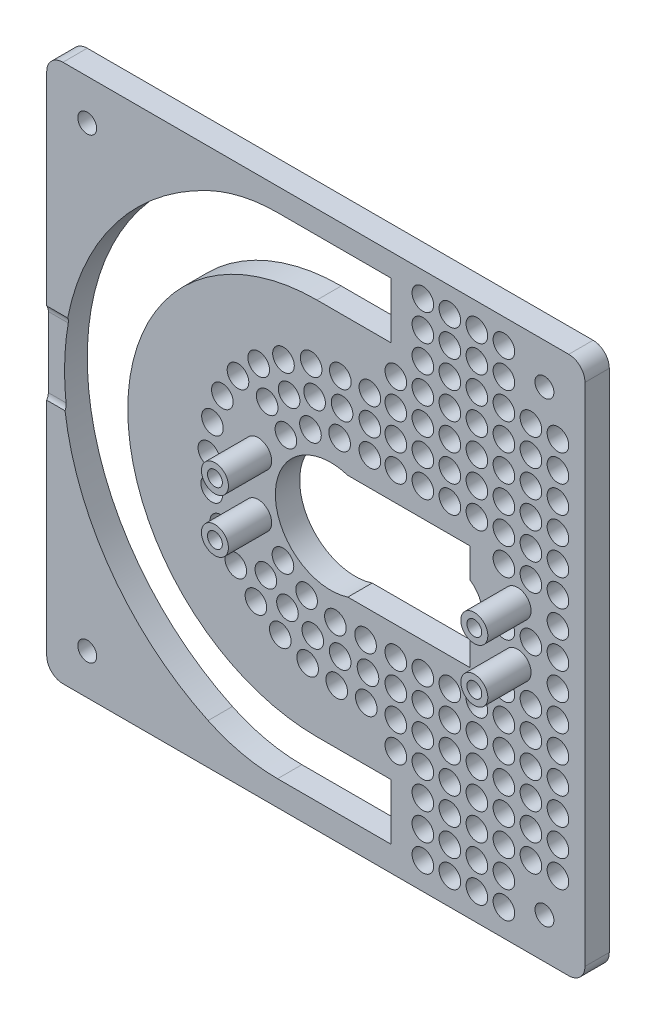
from build123d import *

# Parameters (mm, degrees)
BOSS_EXTRUDE1_DEPTH      = 3
BOSS_EXTRUDE1_DEPTH_BACK = 1.5
SKETCH1_W                = 99.6
SKETCH1_H                = 99.6
SKETCH1_R                = 7.5
SKETCH2_W                = 99.6
SKETCH2_H                = 99.6
SKETCH2_W_2              = 95.6
SKETCH2_H_2              = 95.6
BOSS_EXTRUDE2_DEPTH      = 55
FILLET1_R                = 3
SKETCH5_R                = 3
BOSS_EXTRUDE4_DEPTH      = 55
SKETCH6_R                = 1.5
CUT_EXTRUDE2_DEPTH       = 10
CUT_EXTRUDE4_START       = -99.6
CUT_EXTRUDE4_DEPTH       = 99.6
SKETCH8_W                = 17
SKETCH8_H                = 12.2
SKETCH8_H_2              = 9.2
CUT_EXTRUDE5_DEPTH       = 10
CUT_EXTRUDE13_DEPTH      = 4.5
SKETCH20_7_W             = 13.718214861
SKETCH20_7_H             = 12
CUT_EXTRUDE16_DEPTH      = 4.5
CUT_EXTRUDE17_DEPTH      = 10
SKETCH22_R               = 1.4
CUT_EXTRUDE18_DEPTH      = 10
SKETCH26_R               = 2
CUT_EXTRUDE21_DEPTH      = 4.5
SKETCH29_R               = 2
BOSS_EXTRUDE9_DEPTH      = 4.5
SKETCH30_R               = 2
CUT_EXTRUDE23_DEPTH      = 4.5
CRVPATTERN2_START        = -1.5
CRVPATTERN2_OUTLINE_R    = 2
CRVPATTERN2_DEPTH        = 4.5
SKETCH32_R               = 2
CUT_EXTRUDE24_DEPTH      = 4.5
CRVPATTERN3_START        = -1.5
CRVPATTERN3_OUTLINE_R    = 2
CRVPATTERN3_DEPTH        = 4.5
SKETCH36_R               = 2
CUT_EXTRUDE25_DEPTH      = 4.5
CRVPATTERN4_START        = -1.5
CRVPATTERN4_OUTLINE_R    = 2
CRVPATTERN4_DEPTH        = 4.5
SKETCH37_W               = 26.02554601
SKETCH37_H               = 3
SKETCH37_W_2             = 26.013358107
BOSS_EXTRUDE11_DEPTH     = 4.5
FILLET2_R                = 30
SKETCH38_R               = 2.5
SKETCH38_R_2             = 1.375
BOSS_EXTRUDE12_DEPTH     = 8
CUT_EXTRUDE27_DEPTH      = 2
SKETCH40_R               = 1.75
CUT_EXTRUDE31_DEPTH      = 10
CUT_EXTRUDE32_DEPTH      = 55
CUT_EXTRUDE35_DEPTH      = 10
CUT_EXTRUDE36_DEPTH      = 4.5
SKETCH44_R               = 1.5
CUT_EXTRUDE37_DEPTH      = 2


# Read off the part's stored shape, not the designer's step: CrvPattern2, CrvPattern3, CrvPattern4
with BuildPart() as part:
    # Sketch1 → Boss-Extrude1 (new, two sides: drawn at the far end of the back side and taken through both)
    with BuildSketch(Plane.XY.offset(-BOSS_EXTRUDE1_DEPTH_BACK)):
        with Locations((-24.95, -0.2)):
            Rectangle(SKETCH1_W, SKETCH1_H)
        with Locations((-22.104673791, 0)):
            Circle(SKETCH1_R, mode=Mode.SUBTRACT)
    extrude(amount=BOSS_EXTRUDE1_DEPTH + BOSS_EXTRUDE1_DEPTH_BACK)

    # Sketch2 → Boss-Extrude2 (add)
    with BuildSketch(Plane.XY.offset(3)):
        with Locations((-24.95, -0.2)):
            Rectangle(SKETCH2_W, SKETCH2_H)
        with Locations((-24.95, -0.2)):
            Rectangle(SKETCH2_W_2, SKETCH2_H_2, mode=Mode.SUBTRACT)
    extrude(amount=BOSS_EXTRUDE2_DEPTH)

    # Fillet1
    fillet1_edges = [part.edges().sort_by_distance(p)[0] for p in [
        (-72.75, -48, 30.5),
        (22.85, -48, 30.5),
        (22.85, 47.6, 30.5),
        (-72.75, 47.6, 30.5),
        (-74.75, 49.6, 28.25),
        (24.85, 49.6, 28.25),
        (24.85, -50, 28.25),
        (-74.75, -50, 28.25),
    ]]
    fillet(fillet1_edges, radius=FILLET1_R)

    # Sketch5 → Boss-Extrude4 (add)
    with BuildSketch(Plane.XY.offset(3)):
        with Locations((17.35, 42.1)):
            Circle(SKETCH5_R)
        with Locations((17.35, -42.5)):
            Circle(SKETCH5_R)
        with Locations((-67.25, 42.1)):
            Circle(SKETCH5_R)
        with Locations((-67.25, -42.5)):
            Circle(SKETCH5_R)
    extrude(amount=BOSS_EXTRUDE4_DEPTH)

    # Sketch6 → Cut-Extrude2 (cut)
    with BuildSketch(Plane.XY.offset(58)):
        with Locations((17.35, 42.1)):
            Circle(SKETCH6_R)
        with Locations((17.35, -42.5)):
            Circle(SKETCH6_R)
        with Locations((-67.25, -42.5)):
            Circle(SKETCH6_R)
        with Locations((-67.25, 42.1)):
            Circle(SKETCH6_R)
    extrude(amount=-CUT_EXTRUDE2_DEPTH, mode=Mode.SUBTRACT)

    # Sketch7 → Cut-Extrude4 (cut)
    with BuildSketch(Plane.XZ.offset(50).offset(CUT_EXTRUDE4_START)):
        with BuildLine():
            Line((12.05, 8.25), (12.05, 48.25))
            ThreePointArc((12.05, 48.25), (10.05, 50.25), (8.05, 48.25))
            Line((8.05, 48.25), (8.05, 8.25))
            ThreePointArc((8.05, 8.25), (10.05, 6.25), (12.05, 8.25))
        make_face()
        with BuildLine():
            Line((-1.95, 8.25), (-1.95, 48.25))
            ThreePointArc((-1.95, 48.25), (0.05, 50.25), (2.05, 48.25))
            Line((2.05, 48.25), (2.05, 8.25))
            ThreePointArc((2.05, 8.25), (0.05, 6.25), (-1.95, 8.25))
        make_face()
        with BuildLine():
            Line((-11.95, 8.25), (-11.95, 48.25))
            ThreePointArc((-11.95, 48.25), (-9.95, 50.25), (-7.95, 48.25))
            Line((-7.95, 48.25), (-7.95, 8.25))
            ThreePointArc((-7.95, 8.25), (-9.95, 6.25), (-11.95, 8.25))
        make_face()
        with BuildLine():
            Line((-21.95, 8.25), (-21.95, 48.25))
            ThreePointArc((-21.95, 48.25), (-19.95, 50.25), (-17.95, 48.25))
            Line((-17.95, 48.25), (-17.95, 8.25))
            ThreePointArc((-17.95, 8.25), (-19.95, 6.25), (-21.95, 8.25))
        make_face()
        with BuildLine():
            Line((-31.95, 8.25), (-31.95, 48.25))
            ThreePointArc((-31.95, 48.25), (-29.95, 50.25), (-27.95, 48.25))
            Line((-27.95, 48.25), (-27.95, 8.25))
            ThreePointArc((-27.95, 8.25), (-29.95, 6.25), (-31.95, 8.25))
        make_face()
        with BuildLine():
            Line((-41.95, 8.25), (-41.95, 48.25))
            ThreePointArc((-41.95, 48.25), (-39.95, 50.25), (-37.95, 48.25))
            Line((-37.95, 48.25), (-37.95, 8.25))
            ThreePointArc((-37.95, 8.25), (-39.95, 6.25), (-41.95, 8.25))
        make_face()
        with BuildLine():
            Line((-51.95, 8.25), (-51.95, 48.25))
            ThreePointArc((-51.95, 48.25), (-49.95, 50.25), (-47.95, 48.25))
            Line((-47.95, 48.25), (-47.95, 8.25))
            ThreePointArc((-47.95, 8.25), (-49.95, 6.25), (-51.95, 8.25))
        make_face()
        with BuildLine():
            Line((-61.95, 8.25), (-61.95, 48.25))
            ThreePointArc((-61.95, 48.25), (-59.95, 50.25), (-57.95, 48.25))
            Line((-57.95, 48.25), (-57.95, 8.25))
            ThreePointArc((-57.95, 8.25), (-59.95, 6.25), (-61.95, 8.25))
        make_face()
    cut_extrude4 = extrude(amount=CUT_EXTRUDE4_DEPTH, mode=Mode.SUBTRACT)

    # Mirror1: Cut-Extrude4 across plane
    add(cut_extrude4.mirror(Plane.ZX), mode=Mode.SUBTRACT)

    # Sketch8 → Cut-Extrude5 (cut)
    with BuildSketch(Plane.ZY.offset(74.75)):
        with Locations((49.5, -10.4)):
            Rectangle(SKETCH8_W, SKETCH8_H)
        with Locations((49.5, 19.6)):
            Rectangle(SKETCH8_W, SKETCH8_H_2)
    extrude(amount=-CUT_EXTRUDE5_DEPTH, mode=Mode.SUBTRACT)

    # Sketch20 → Cut-Extrude13 (cut)
    with BuildSketch(Plane(origin=(0, 0, -1.5), x_dir=(-1, 0, 0), z_dir=(0, 0, -1))):
        with BuildLine():
            ThreePointArc((24.75, -47), (71.75, 0), (24.75, 47))
            Line((24.75, 47), (24.75, 35))
            ThreePointArc((24.75, 35), (59.75, 0), (24.75, -35))
            Line((24.75, -35), (24.75, -47))
        make_face()
    extrude(amount=-CUT_EXTRUDE13_DEPTH, mode=Mode.SUBTRACT)

    # Sketch20<7> → Cut-Extrude16 (cut)
    with BuildSketch(Plane(origin=(0, 0, -1.5), x_dir=(-1, 0, 0), z_dir=(0, 0, -1))):
        with Locations((17.89089257, 41)):
            Rectangle(SKETCH20_7_W, SKETCH20_7_H)
        with Locations((17.89089257, -41)):
            Rectangle(SKETCH20_7_W, SKETCH20_7_H)
    extrude(amount=-CUT_EXTRUDE16_DEPTH, mode=Mode.SUBTRACT)

    # Sketch21 → Cut-Extrude17 (cut)
    with BuildSketch(Plane.ZY.offset(74.75)):
        with BuildLine():
            Line((4.7, -7), (16.2, -7))
            ThreePointArc((16.2, -7), (17.614213562, -6.414213562), (18.2, -5))
            Line((18.2, -5), (18.2, 8))
            ThreePointArc((18.2, 8), (17.614213562, 9.414213562), (16.2, 10))
            Line((16.2, 10), (4.7, 10))
            ThreePointArc((4.7, 10), (3.285786438, 9.414213562), (2.7, 8))
            Line((2.7, 8), (2.7, -5))
            ThreePointArc((2.7, -5), (3.285786438, -6.414213562), (4.7, -7))
        make_face()
    extrude(amount=-CUT_EXTRUDE17_DEPTH, mode=Mode.SUBTRACT)

    # Sketch22 → Cut-Extrude18 (cut)
    with BuildSketch(Plane(origin=(-72.75, 0, 0), x_dir=(0, 0, -1), z_dir=(1, 0, 0))):
        with Locations(Location((-28.5, 1.5, 0), (0, 0, 90))):
            Circle(SKETCH22_R)
    extrude(amount=-CUT_EXTRUDE18_DEPTH, mode=Mode.SUBTRACT)

    # Sketch26 → Cut-Extrude21 (cut)
    with BuildSketch(Plane(origin=(0, 0, -1.5), x_dir=(-1, 0, 0), z_dir=(0, 0, -1))):
        with Locations((-19.85, -45)):
            Circle(SKETCH26_R)
        with Locations((-19.85, -40)):
            Circle(SKETCH26_R)
        with Locations((-19.85, -35)):
            Circle(SKETCH26_R)
        with Locations((-19.85, -30)):
            Circle(SKETCH26_R)
        with Locations((-19.85, -25)):
            Circle(SKETCH26_R)
        with Locations((-19.85, -20)):
            Circle(SKETCH26_R)
        with Locations((-19.85, -15)):
            Circle(SKETCH26_R)
        with Locations((-19.85, -10)):
            Circle(SKETCH26_R)
        with Locations((-19.85, -5)):
            Circle(SKETCH26_R)
        with Locations((-19.85, 0)):
            Circle(SKETCH26_R)
        with Locations((-19.85, 5)):
            Circle(SKETCH26_R)
        with Locations((-19.85, 10)):
            Circle(SKETCH26_R)
        with Locations((-19.85, 15)):
            Circle(SKETCH26_R)
        with Locations((-19.85, 20)):
            Circle(SKETCH26_R)
        with Locations((-19.85, 25)):
            Circle(SKETCH26_R)
        with Locations((-19.85, 30)):
            Circle(SKETCH26_R)
        with Locations((-19.85, 35)):
            Circle(SKETCH26_R)
        with Locations((-19.85, 40)):
            Circle(SKETCH26_R)
        with Locations((-19.85, 45)):
            Circle(SKETCH26_R)
        with Locations((-14.85, -45)):
            Circle(SKETCH26_R)
        with Locations((-9.85, -45)):
            Circle(SKETCH26_R)
        with Locations((-4.85, -45)):
            Circle(SKETCH26_R)
        with Locations((0.15, -45)):
            Circle(SKETCH26_R)
        with Locations((5.15, -45)):
            Circle(SKETCH26_R)
        with Locations((-14.85, -40)):
            Circle(SKETCH26_R)
        with Locations((-9.85, -40)):
            Circle(SKETCH26_R)
        with Locations((-4.85, -40)):
            Circle(SKETCH26_R)
        with Locations((0.15, -40)):
            Circle(SKETCH26_R)
        with Locations((5.15, -40)):
            Circle(SKETCH26_R)
        with Locations((-14.85, -35)):
            Circle(SKETCH26_R)
        with Locations((-9.85, -35)):
            Circle(SKETCH26_R)
        with Locations((-4.85, -35)):
            Circle(SKETCH26_R)
        with Locations((0.15, -35)):
            Circle(SKETCH26_R)
        with Locations((5.15, -35)):
            Circle(SKETCH26_R)
        with Locations((-14.85, -30)):
            Circle(SKETCH26_R)
        with Locations((-9.85, -30)):
            Circle(SKETCH26_R)
        with Locations((-4.85, -30)):
            Circle(SKETCH26_R)
        with Locations((0.15, -30)):
            Circle(SKETCH26_R)
        with Locations((5.15, -30)):
            Circle(SKETCH26_R)
        with Locations((-14.85, -25)):
            Circle(SKETCH26_R)
        with Locations((-9.85, -25)):
            Circle(SKETCH26_R)
        with Locations((-4.85, -25)):
            Circle(SKETCH26_R)
        with Locations((0.15, -25)):
            Circle(SKETCH26_R)
        with Locations((5.15, -25)):
            Circle(SKETCH26_R)
        with Locations((-14.85, -20)):
            Circle(SKETCH26_R)
        with Locations((-9.85, -20)):
            Circle(SKETCH26_R)
        with Locations((-4.85, -20)):
            Circle(SKETCH26_R)
        with Locations((0.15, -20)):
            Circle(SKETCH26_R)
        with Locations((5.15, -20)):
            Circle(SKETCH26_R)
        with Locations((-14.85, -15)):
            Circle(SKETCH26_R)
        with Locations((-9.85, -15)):
            Circle(SKETCH26_R)
        with Locations((-4.85, -15)):
            Circle(SKETCH26_R)
        with Locations((0.15, -15)):
            Circle(SKETCH26_R)
        with Locations((5.15, -15)):
            Circle(SKETCH26_R)
        with Locations((-14.85, -10)):
            Circle(SKETCH26_R)
        with Locations((-9.85, -10)):
            Circle(SKETCH26_R)
        with Locations((-14.85, 0)):
            Circle(SKETCH26_R)
        with Locations((-9.85, 0)):
            Circle(SKETCH26_R)
        with Locations((-14.85, 10)):
            Circle(SKETCH26_R)
        with Locations((-9.85, 10)):
            Circle(SKETCH26_R)
        with Locations((-14.85, 15)):
            Circle(SKETCH26_R)
        with Locations((-9.85, 15)):
            Circle(SKETCH26_R)
        with Locations((-4.85, 15)):
            Circle(SKETCH26_R)
        with Locations((0.15, 15)):
            Circle(SKETCH26_R)
        with Locations((5.15, 15)):
            Circle(SKETCH26_R)
        with Locations((-14.85, 20)):
            Circle(SKETCH26_R)
        with Locations((-9.85, 20)):
            Circle(SKETCH26_R)
        with Locations((-4.85, 20)):
            Circle(SKETCH26_R)
        with Locations((0.15, 20)):
            Circle(SKETCH26_R)
        with Locations((5.15, 20)):
            Circle(SKETCH26_R)
        with Locations((-14.85, 25)):
            Circle(SKETCH26_R)
        with Locations((-9.85, 25)):
            Circle(SKETCH26_R)
        with Locations((-4.85, 25)):
            Circle(SKETCH26_R)
        with Locations((0.15, 25)):
            Circle(SKETCH26_R)
        with Locations((5.15, 25)):
            Circle(SKETCH26_R)
        with Locations((-14.85, 30)):
            Circle(SKETCH26_R)
        with Locations((-9.85, 30)):
            Circle(SKETCH26_R)
        with Locations((-4.85, 30)):
            Circle(SKETCH26_R)
        with Locations((0.15, 30)):
            Circle(SKETCH26_R)
        with Locations((5.15, 30)):
            Circle(SKETCH26_R)
        with Locations((-14.85, 35)):
            Circle(SKETCH26_R)
        with Locations((-9.85, 35)):
            Circle(SKETCH26_R)
        with Locations((-4.85, 35)):
            Circle(SKETCH26_R)
        with Locations((0.15, 35)):
            Circle(SKETCH26_R)
        with Locations((5.15, 35)):
            Circle(SKETCH26_R)
        with Locations((-14.85, 40)):
            Circle(SKETCH26_R)
        with Locations((-9.85, 40)):
            Circle(SKETCH26_R)
        with Locations((-4.85, 40)):
            Circle(SKETCH26_R)
        with Locations((0.15, 40)):
            Circle(SKETCH26_R)
        with Locations((5.15, 40)):
            Circle(SKETCH26_R)
        with Locations((-14.85, 45)):
            Circle(SKETCH26_R)
        with Locations((-9.85, 45)):
            Circle(SKETCH26_R)
        with Locations((-4.85, 45)):
            Circle(SKETCH26_R)
        with Locations((0.15, 45)):
            Circle(SKETCH26_R)
        with Locations((5.15, 45)):
            Circle(SKETCH26_R)
        with Locations((10.15, -30)):
            Circle(SKETCH26_R)
        with Locations((10.15, -25)):
            Circle(SKETCH26_R)
        with Locations((10.15, -20)):
            Circle(SKETCH26_R)
        with Locations((10.15, -15)):
            Circle(SKETCH26_R)
        with Locations((10.15, 15)):
            Circle(SKETCH26_R)
        with Locations((10.15, 20)):
            Circle(SKETCH26_R)
        with Locations((10.15, 25)):
            Circle(SKETCH26_R)
        with Locations((10.15, 30)):
            Circle(SKETCH26_R)
    extrude(amount=-CUT_EXTRUDE21_DEPTH, mode=Mode.SUBTRACT)

    # Sketch29 → Boss-Extrude9 (add)
    with BuildSketch(Plane(origin=(0, 0, -1.5), x_dir=(-1, 0, 0), z_dir=(0, 0, -1))):
        with Locations((-19.85, 40)):
            Circle(SKETCH29_R)
        with Locations((-19.85, 45)):
            Circle(SKETCH29_R)
        with Locations((-14.85, 45)):
            Circle(SKETCH29_R)
        with Locations((-14.85, 40)):
            Circle(SKETCH29_R)
        with Locations((-19.85, -40)):
            Circle(SKETCH29_R)
        with Locations((-19.85, -45)):
            Circle(SKETCH29_R)
        with Locations((-14.85, -45)):
            Circle(SKETCH29_R)
        with Locations((-14.85, -40)):
            Circle(SKETCH29_R)
    extrude(amount=-BOSS_EXTRUDE9_DEPTH)

    # Sketch30 → Cut-Extrude23 (cut)
    with BuildSketch(Plane(origin=(0, 0, -1.5), x_dir=(-1, 0, 0), z_dir=(0, 0, -1))):
        with Locations((14.95, 20)):
            Circle(SKETCH30_R)
    extrude(amount=-CUT_EXTRUDE23_DEPTH, mode=Mode.SUBTRACT)

    # CrvPattern2 outline → CrvPattern2 (cut)
    with BuildSketch(Plane.XY.offset(CRVPATTERN2_START)):
        with Locations((-20.098772525, 19.996958712)):
            Circle(CRVPATTERN2_OUTLINE_R)
        with Locations((-25.178610025, 19.249160844)):
            Circle(CRVPATTERN2_OUTLINE_R)
        with Locations((-29.900648507, 17.232653159)):
            Circle(CRVPATTERN2_OUTLINE_R)
        with Locations((-33.953658998, 14.080343429)):
            Circle(CRVPATTERN2_OUTLINE_R)
        with Locations((-34.197040973, -13.830510009)):
            Circle(CRVPATTERN2_OUTLINE_R)
        with Locations((-30.199618752, -17.05301932)):
            Circle(CRVPATTERN2_OUTLINE_R)
        with Locations((-25.513463448, -19.151566231)):
            Circle(CRVPATTERN2_OUTLINE_R)
        with Locations((-20.447438978, -19.987835773)):
            Circle(CRVPATTERN2_OUTLINE_R)
        with Locations((-15.298790205, -20)):
            Circle(CRVPATTERN2_OUTLINE_R)
    extrude(amount=CRVPATTERN2_DEPTH, mode=Mode.SUBTRACT)

    # Sketch32 → Cut-Extrude24 (cut)
    with BuildSketch(Plane(origin=(0, 0, -1.5), x_dir=(-1, 0, 0), z_dir=(0, 0, -1))):
        with Locations((14.95, 15)):
            Circle(SKETCH32_R)
    extrude(amount=-CUT_EXTRUDE24_DEPTH, mode=Mode.SUBTRACT)

    # CrvPattern3 outline → CrvPattern3 (cut)
    with BuildSketch(Plane.XY.offset(CRVPATTERN3_START)):
        with Locations((-20.542711439, 14.979038974)):
            Circle(CRVPATTERN3_OUTLINE_R)
        with Locations((-25.944978829, 13.660974976)):
            Circle(CRVPATTERN3_OUTLINE_R)
        with Locations((-30.495869297, 10.465481024)):
            Circle(CRVPATTERN3_OUTLINE_R)
        with Locations((-31.033926769, -9.882964974)):
            Circle(CRVPATTERN3_OUTLINE_R)
        with Locations((-26.658269364, -13.3144964)):
            Circle(CRVPATTERN3_OUTLINE_R)
        with Locations((-21.333207406, -14.916214477)):
            Circle(CRVPATTERN3_OUTLINE_R)
        with Locations((-15.743080891, -15)):
            Circle(CRVPATTERN3_OUTLINE_R)
    extrude(amount=CRVPATTERN3_DEPTH, mode=Mode.SUBTRACT)

    # Sketch36 → Cut-Extrude25 (cut)
    with BuildSketch(Plane(origin=(0, 0, -1.5), x_dir=(-1, 0, 0), z_dir=(0, 0, -1))):
        with Locations((14.95, 25)):
            Circle(SKETCH36_R)
    extrude(amount=-CUT_EXTRUDE25_DEPTH, mode=Mode.SUBTRACT)

    # CrvPattern4 outline → CrvPattern4 (cut)
    with BuildSketch(Plane.XY.offset(CRVPATTERN4_START)):
        with Locations((-20.416968875, 24.991101467)):
            Circle(CRVPATTERN4_OUTLINE_R)
        with Locations((-15.61704802, -25)):
            Circle(CRVPATTERN4_OUTLINE_R)
        with Locations((-21.083462946, -24.964412202)):
            Circle(CRVPATTERN4_OUTLINE_R)
        with Locations((-26.467563085, -24.080580271)):
            Circle(CRVPATTERN4_OUTLINE_R)
        with Locations((-42.536029609, -10.285759799)):
            Circle(CRVPATTERN4_OUTLINE_R)
        with Locations((-39.76193826, -14.98406911)):
            Circle(CRVPATTERN4_OUTLINE_R)
        with Locations((-36.034648091, -18.968664596)):
            Circle(CRVPATTERN4_OUTLINE_R)
        with Locations((-31.531695558, -22.049753962)):
            Circle(CRVPATTERN4_OUTLINE_R)
        with Locations((-44.224787982, -5.097524227)):
            Circle(CRVPATTERN4_OUTLINE_R)
        with Locations((-44.747775268, 0.333514117)):
            Circle(CRVPATTERN4_OUTLINE_R)
        with Locations((-44.080080793, 5.74866668)):
            Circle(CRVPATTERN4_OUTLINE_R)
        with Locations((-42.253507854, 10.890001574)):
            Circle(CRVPATTERN4_OUTLINE_R)
        with Locations((-35.522791356, 19.396367001)):
            Circle(CRVPATTERN4_OUTLINE_R)
        with Locations((-39.355058875, 15.512629258)):
            Circle(CRVPATTERN4_OUTLINE_R)
        with Locations((-30.939241982, 22.356226512)):
            Circle(CRVPATTERN4_OUTLINE_R)
        with Locations((-25.822732126, 24.251225217)):
            Circle(CRVPATTERN4_OUTLINE_R)
    extrude(amount=CRVPATTERN4_DEPTH, mode=Mode.SUBTRACT)

    # Sketch37 → Boss-Extrude11 (add)
    with BuildSketch(Plane(origin=(0, 0, -1.5), x_dir=(-1, 0, 0), z_dir=(0, 0, -1))):
        with Locations((24.044558144, -46.86)):
            Rectangle(SKETCH37_W, SKETCH37_H)
        with Locations((24.038464193, 46.863305133)):
            Rectangle(SKETCH37_W_2, SKETCH37_H)
    extrude(amount=-BOSS_EXTRUDE11_DEPTH)

    # Fillet2
    fillet2_edges = [part.edges().sort_by_distance(p)[0] for p in [
        (-37.057331149, -45.36, 0.75),
        (-37.045143246, 45.363305133, 0.75),
    ]]
    fillet(fillet2_edges, radius=FILLET2_R)

    # Sketch38 → Boss-Extrude12 (add)
    # profile 1 of 4: a face of its own
    with BuildSketch(Plane.XY.offset(3)):
        with Locations((-35.624093115, -4.902903378)):
            Circle(SKETCH38_R)
        with Locations((-35.624093115, -4.902903378)):
            Circle(SKETCH38_R_2, mode=Mode.SUBTRACT)
    # profile 2 of 4: a face of its own
    with BuildSketch(Plane.XY.offset(3)):
        with Locations((-35.624093115, 5)):
            Circle(SKETCH38_R)
        with Locations((-35.624093115, 5)):
            Circle(SKETCH38_R_2, mode=Mode.SUBTRACT)
    # profile 3 of 4: a face of its own
    with BuildSketch(Plane.XY.offset(3)):
        with Locations((12.375906885, 5)):
            Circle(SKETCH38_R)
        with Locations((12.375906885, 5)):
            Circle(SKETCH38_R_2, mode=Mode.SUBTRACT)
    # profile 4 of 4: a face of its own
    with BuildSketch(Plane.XY.offset(3)):
        with Locations((12.375906885, -4.902903378)):
            Circle(SKETCH38_R)
        with Locations((12.375906885, -4.902903378)):
            Circle(SKETCH38_R_2, mode=Mode.SUBTRACT)
    extrude(amount=BOSS_EXTRUDE12_DEPTH)

    # Sketch39 → Cut-Extrude27 (cut)
    with BuildSketch(Plane(origin=(24.85, 0, 0), x_dir=(0, 0, -1), z_dir=(1, 0, 0))):
        with BuildLine():
            Line((-10.75, 36.8), (-50.75, 36.8))
            ThreePointArc((-50.75, 36.8), (-52.75, 34.8), (-50.75, 32.8))
            Line((-50.75, 32.8), (-10.75, 32.8))
            ThreePointArc((-10.75, 32.8), (-8.75, 34.8), (-10.75, 36.8))
        make_face()
        with BuildLine():
            Line((-50.75, 22.8), (-10.75, 22.8))
            ThreePointArc((-10.75, 22.8), (-8.75, 24.8), (-10.75, 26.8))
            Line((-10.75, 26.8), (-50.75, 26.8))
            ThreePointArc((-50.75, 26.8), (-52.75, 24.8), (-50.75, 22.8))
        make_face()
        with BuildLine():
            Line((-50.75, 12.8), (-10.75, 12.8))
            ThreePointArc((-10.75, 12.8), (-8.75, 14.8), (-10.75, 16.8))
            Line((-10.75, 16.8), (-50.75, 16.8))
            ThreePointArc((-50.75, 16.8), (-52.75, 14.8), (-50.75, 12.8))
        make_face()
        with BuildLine():
            Line((-50.75, 2.8), (-10.75, 2.8))
            ThreePointArc((-10.75, 2.8), (-8.75, 4.8), (-10.75, 6.8))
            Line((-10.75, 6.8), (-50.75, 6.8))
            ThreePointArc((-50.75, 6.8), (-52.75, 4.8), (-50.75, 2.8))
        make_face()
        with BuildLine():
            Line((-50.75, -7.2), (-10.75, -7.2))
            ThreePointArc((-10.75, -7.2), (-8.75, -5.2), (-10.75, -3.2))
            Line((-10.75, -3.2), (-50.75, -3.2))
            ThreePointArc((-50.75, -3.2), (-52.75, -5.2), (-50.75, -7.2))
        make_face()
        with BuildLine():
            Line((-50.75, -17.2), (-10.75, -17.2))
            ThreePointArc((-10.75, -17.2), (-8.75, -15.2), (-10.75, -13.2))
            Line((-10.75, -13.2), (-50.75, -13.2))
            ThreePointArc((-50.75, -13.2), (-52.75, -15.2), (-50.75, -17.2))
        make_face()
        with BuildLine():
            Line((-50.75, -27.2), (-10.75, -27.2))
            ThreePointArc((-10.75, -27.2), (-8.75, -25.2), (-10.75, -23.2))
            Line((-10.75, -23.2), (-50.75, -23.2))
            ThreePointArc((-50.75, -23.2), (-52.75, -25.2), (-50.75, -27.2))
        make_face()
        with BuildLine():
            Line((-50.75, -37.2), (-10.75, -37.2))
            ThreePointArc((-10.75, -37.2), (-8.75, -35.2), (-10.75, -33.2))
            Line((-10.75, -33.2), (-50.75, -33.2))
            ThreePointArc((-50.75, -33.2), (-52.75, -35.2), (-50.75, -37.2))
        make_face()
    extrude(amount=-CUT_EXTRUDE27_DEPTH, mode=Mode.SUBTRACT)

    # Sketch40 → Cut-Extrude31 (cut)
    with BuildSketch(Plane.XY.offset(3)):
        with Locations((17.35, -42.5)):
            Circle(SKETCH40_R)
        with Locations((-67.25, -42.5)):
            Circle(SKETCH40_R)
        with Locations((-67.25, 42.1)):
            Circle(SKETCH40_R)
        with Locations((17.35, 42.1)):
            Circle(SKETCH40_R)
    extrude(amount=-CUT_EXTRUDE31_DEPTH, mode=Mode.SUBTRACT)

    # Sketch41 → Cut-Extrude32 (cut)
    with BuildSketch(Plane.XY.offset(3)):
        Polygon((35.771120156, 51.696135285), (35.771120156, -68.339230689), (-98.454568293, -68.339230689), (-95.460668494, 61.230928926), align=None)
        Polygon((18.480492177, 13.542451262), (18.480492177, -12.758182434), (-49.618536882, -12.758182434), (-49.618536882, 16.478808638), align=None, mode=Mode.SUBTRACT)
    extrude(amount=CUT_EXTRUDE32_DEPTH, mode=Mode.SUBTRACT)

    # Sketch42 → Cut-Extrude35 (cut)
    with BuildSketch(Plane(origin=(0, 0, -1.5), x_dir=(-1, 0, 0), z_dir=(0, 0, -1))):
        with BuildLine():
            Line((-3.057683491, 9.75), (-3.057683491, 4.242640687))
            ThreePointArc((-3.057683491, 4.242640687), (-5.057683491, 0), (-3.057683491, -4.242640687))
            Line((-3.057683491, -4.242640687), (-3.057683491, -9.75))
            Line((-3.057683491, -9.75), (19.030038849, -9.75))
            ThreePointArc((19.030038849, -9.75), (32.442316509, 0), (19.030038849, 9.75))
            Line((19.030038849, 9.75), (-3.057683491, 9.75))
        make_face()
    extrude(amount=-CUT_EXTRUDE35_DEPTH, mode=Mode.SUBTRACT)

    # Sketch43 → Cut-Extrude36 (cut)
    with BuildSketch(Plane(origin=(0, 0, -1.5), x_dir=(-1, 0, 0), z_dir=(0, 0, -1))):
        with BuildLine():
            Line((-3.057683491, -9.75), (-3.557683491, -9.75))
            Line((-3.557683491, -9.75), (-3.557683491, -4.296321376))
            ThreePointArc((-3.557683491, -4.296321376), (-5.878167566, 0), (-3.557683491, 4.296321376))
            Line((-3.557683491, 4.296321376), (-3.557683491, 9.75))
            Line((-3.557683491, 9.75), (-3.057683491, 9.75))
            Line((-3.057683491, 9.75), (-3.057683491, 4.585346664))
            Line((-3.057683491, 4.585346664), (-3.057683491, -4.585346664))
            Line((-3.057683491, -4.585346664), (-3.057683491, -9.75))
        make_face()
    extrude(amount=-CUT_EXTRUDE36_DEPTH, mode=Mode.SUBTRACT)

    # Sketch44 → Cut-Extrude37 (cut)
    with BuildSketch(Plane.XY.offset(3)):
        with Locations((12.375906885, -4.902903378)):
            Circle(SKETCH44_R)
        with Locations((12.375906885, 5)):
            Circle(SKETCH44_R)
        with Locations((-35.624093115, 5)):
            Circle(SKETCH44_R)
        with Locations((-35.624093115, -4.902903378)):
            Circle(SKETCH44_R)
    extrude(amount=-CUT_EXTRUDE37_DEPTH, mode=Mode.SUBTRACT)


solid = part.part
